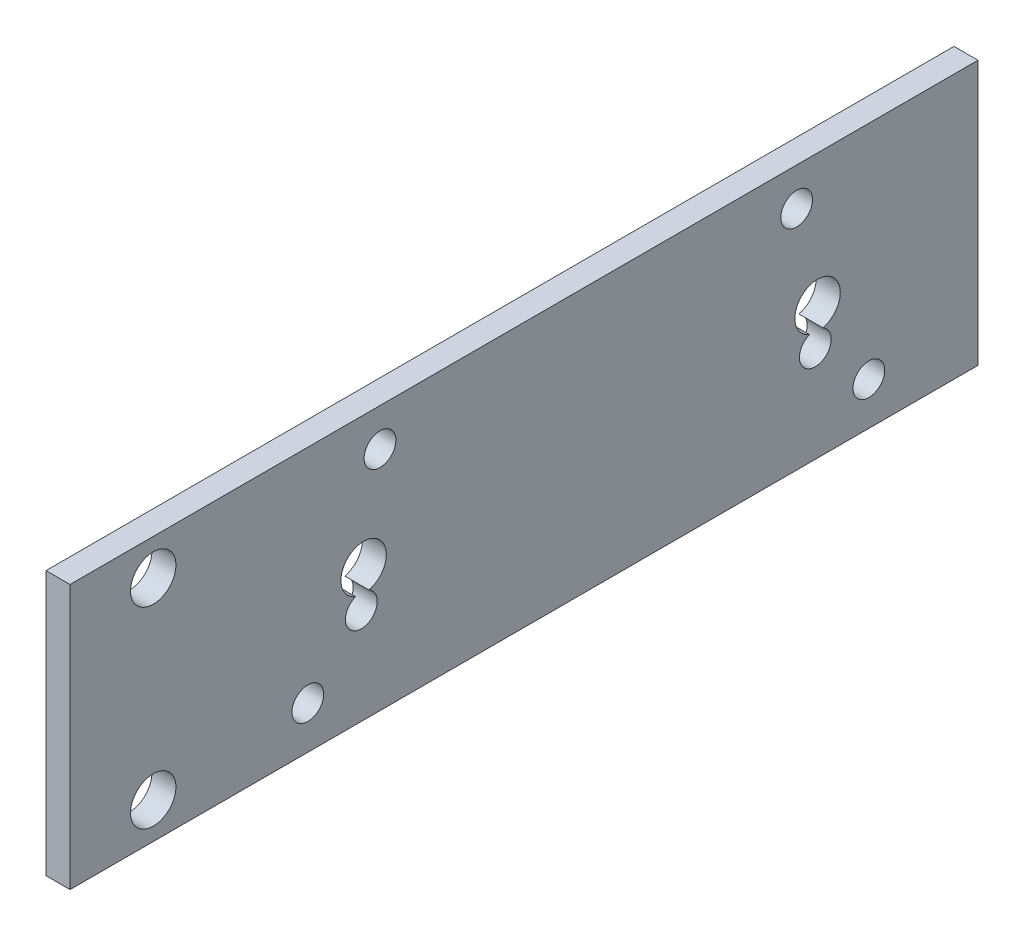
from build123d import *

# Parameters (mm, degrees)
SKETCH1_W                      = 38.1
SKETCH1_H                      = 120
BOSS_EXTRUDE1_DEPTH            = 38.1
SKETCH2_W                      = 34.925
SKETCH2_H                      = 34.925
CUT_EXTRUDE1_DEPTH             = 130.767142413
F_4_2_4_2_DIAMETER_HOLE1_D     = 4.2
F_6_0_6_DIAMETER_HOLE1_D       = 6
F_4_2_4_2_DIAMETER_HOLE2_D     = 4.2
F_4_2_4_2_DIAMETER_HOLE2_DEPTH = 38.1
F_6_0_6_DIAMETER_HOLE2_D       = 6
F_6_0_6_DIAMETER_HOLE2_DEPTH   = 38.1
F_6_0_6_DIAMETER_HOLE3_D       = 6
F_6_0_6_DIAMETER_HOLE3_DEPTH   = 38.1
F_4_2_4_2_DIAMETER_HOLE3_D     = 4.2
SKETCH15_R                     = 2.1
SKETCH15_R_2                   = 3
BOSS_EXTRUDE2_DEPTH            = 3.175
BOSS_EXTRUDE3_START            = -3.175
SKETCH16_R                     = 2.1
BOSS_EXTRUDE3_DEPTH            = 3.175
SKETCH18_W                     = 3.175
SKETCH18_H                     = 3.175
CUT_EXTRUDE2_DEPTH             = 130.767142413
CUT_EXTRUDE3_START             = -3.175
CUT_EXTRUDE3_OUTLINE_R         = 2.1
CUT_EXTRUDE3_DEPTH             = 3.175
BOSS_EXTRUDE4_START            = -3.175
BOSS_EXTRUDE4_OUTLINE_R        = 3
BOSS_EXTRUDE4_DEPTH            = 3.175
SKETCH19_R                     = 3
CUT_EXTRUDE4_DEPTH             = 121.228267267


# Read off the part's stored shape, not the designer's step: Cut-Extrude3, Boss-Extrude4
with BuildPart() as part:
    # Sketch1 → Boss-Extrude1 (new body)
    with BuildSketch(Plane.XZ.offset(34.925)):
        with Locations((15.875, -55)):
            Rectangle(SKETCH1_W, SKETCH1_H)
    extrude(amount=-BOSS_EXTRUDE1_DEPTH)

    # Sketch2 → Cut-Extrude1 (cut, through all)
    with BuildSketch(Plane(origin=(0, 0, -115), x_dir=(-1, 0, 0), z_dir=(0, 0, -1))):
        with Locations((-17.4625, -17.4625)):
            Rectangle(SKETCH2_W, SKETCH2_H)
    extrude(amount=-CUT_EXTRUDE1_DEPTH, mode=Mode.SUBTRACT)

    # Ø4.2 (4.2) Diameter Hole1 (through all)
    with Locations(Plane(origin=(0, 0, 0), x_dir=(-1, 0, 0), z_dir=(0, -1, 0))):
        with Locations((-5, 35.97), (-5, 91.03)):
            Hole(F_4_2_4_2_DIAMETER_HOLE1_D / 2)

    # Ø6.0 (6) Diameter Hole1 (through all)
    with Locations(Plane(origin=(0, 0, 0), x_dir=(-1, 0, 0), z_dir=(0, -1, 0))):
        with Locations((-22.225, 106.5), (-22.225, 46.5)):
            Hole(F_6_0_6_DIAMETER_HOLE1_D / 2)

    # Ø4.2 (4.2) Diameter Hole2
    with Locations(Plane(origin=(0, 3.175, 0), x_dir=(1, 0, 0), z_dir=(0, 1, 0))):
        with Locations((22.225, 33.5), (22.225, 93.5), (29.296067812, 100.571067812), (29.296067812, 26.428932188)):
            Hole(F_4_2_4_2_DIAMETER_HOLE2_D / 2, depth=F_4_2_4_2_DIAMETER_HOLE2_DEPTH)

    # Ø6.0 (6) Diameter Hole2
    with Locations(Plane(origin=(0, 3.175, 0), x_dir=(1, 0, 0), z_dir=(0, 1, 0))):
        with Locations((24.925, 6)):
            Hole(F_6_0_6_DIAMETER_HOLE2_D / 2, depth=F_6_0_6_DIAMETER_HOLE2_DEPTH)

    # Ø6.0 (6) Diameter Hole3
    with Locations(Plane.ZY.offset(3.175)):
        with Locations((-6, -24.925), (-106.5, -22.225), (-46.5, -22.225)):
            Hole(F_6_0_6_DIAMETER_HOLE3_D / 2, depth=F_6_0_6_DIAMETER_HOLE3_DEPTH)

    # Ø4.2 (4.2) Diameter Hole3 (through all)
    with Locations(Plane.ZY.offset(3.175)):
        with Locations((-93.5, -22.225), (-33.5, -22.225), (-35.97, -5), (-91.03, -5), (-100.571067812, -29.296067812), (-26.428932188, -29.296067812)):
            Hole(F_4_2_4_2_DIAMETER_HOLE3_D / 2)

    # Sketch15 → Boss-Extrude2 (add)
    with BuildSketch(Plane(origin=(0, 3.175, 0), x_dir=(1, 0, 0), z_dir=(0, 1, 0))):
        with Locations((29.296067812, 26.428932188)):
            Circle(SKETCH15_R)
        with Locations((29.296067812, 100.571067812)):
            Circle(SKETCH15_R)
        with Locations((22.225, 106.5)):
            Circle(SKETCH15_R_2)
        with Locations((22.225, 46.5)):
            Circle(SKETCH15_R_2)
        with Locations((5, 35.97)):
            Circle(SKETCH15_R)
        with Locations((5, 91.03)):
            Circle(SKETCH15_R)
    extrude(amount=-BOSS_EXTRUDE2_DEPTH)

    # Sketch16 → Boss-Extrude3 (add)
    with BuildSketch(Plane.ZY.offset(3.175).offset(BOSS_EXTRUDE3_START)):
        with Locations((-100.571067812, -29.296067812)):
            Circle(SKETCH16_R)
        with Locations((-26.428932188, -29.296067812)):
            Circle(SKETCH16_R)
        with Locations((-35.97, -5)):
            Circle(SKETCH16_R)
        with Locations((-91.03, -5)):
            Circle(SKETCH16_R)
    extrude(amount=BOSS_EXTRUDE3_DEPTH)

    # Sketch18 → Cut-Extrude2 (cut, through all)
    with BuildSketch(Plane.XY.offset(5)):
        with Locations((-1.5875, 1.5875)):
            Rectangle(SKETCH18_W, SKETCH18_H)
    extrude(amount=-CUT_EXTRUDE2_DEPTH, mode=Mode.SUBTRACT)


with BuildPart() as body_2:
    # of the pieces the cut leaves, the one that is kept (cut_extrude2_keep)
    add(part.part.solids().sort_by_distance((-3.175, -34.925, -115))[0])

    # Cut-Extrude3 outline → Cut-Extrude3 (cut)
    with BuildSketch(Plane.YZ.offset(CUT_EXTRUDE3_START)):
        with Locations((-5, -91.03)):
            Circle(CUT_EXTRUDE3_OUTLINE_R)
        with Locations((-5, -35.97)):
            Circle(CUT_EXTRUDE3_OUTLINE_R)
        with Locations((-29.296067812, -26.428932188)):
            Circle(CUT_EXTRUDE3_OUTLINE_R)
        with Locations((-29.296067812, -100.571067812)):
            Circle(CUT_EXTRUDE3_OUTLINE_R)
    extrude(amount=CUT_EXTRUDE3_DEPTH, mode=Mode.SUBTRACT)

    # Boss-Extrude4 outline → Boss-Extrude4 (add)
    with BuildSketch(Plane.YZ.offset(BOSS_EXTRUDE4_START)):
        with Locations((-22.225, -46.5)):
            Circle(BOSS_EXTRUDE4_OUTLINE_R)
        with Locations((-22.225, -106.5)):
            Circle(BOSS_EXTRUDE4_OUTLINE_R)
        with Locations((-24.925, -6)):
            Circle(BOSS_EXTRUDE4_OUTLINE_R)
    extrude(amount=BOSS_EXTRUDE4_DEPTH)

    # Sketch19 → Cut-Extrude4 (cut, through all)
    with BuildSketch(Plane.ZY.offset(3.175)):
        with Locations((-93.8, -17.4625)):
            Circle(SKETCH19_R)
        with Locations((-33.8, -17.4625)):
            Circle(SKETCH19_R)
        with Locations((-6, -4.7625)):
            Circle(SKETCH19_R)
        with Locations((-6, -30.1625)):
            Circle(SKETCH19_R)
    extrude(amount=-CUT_EXTRUDE4_DEPTH, mode=Mode.SUBTRACT)


solid = body_2.part
